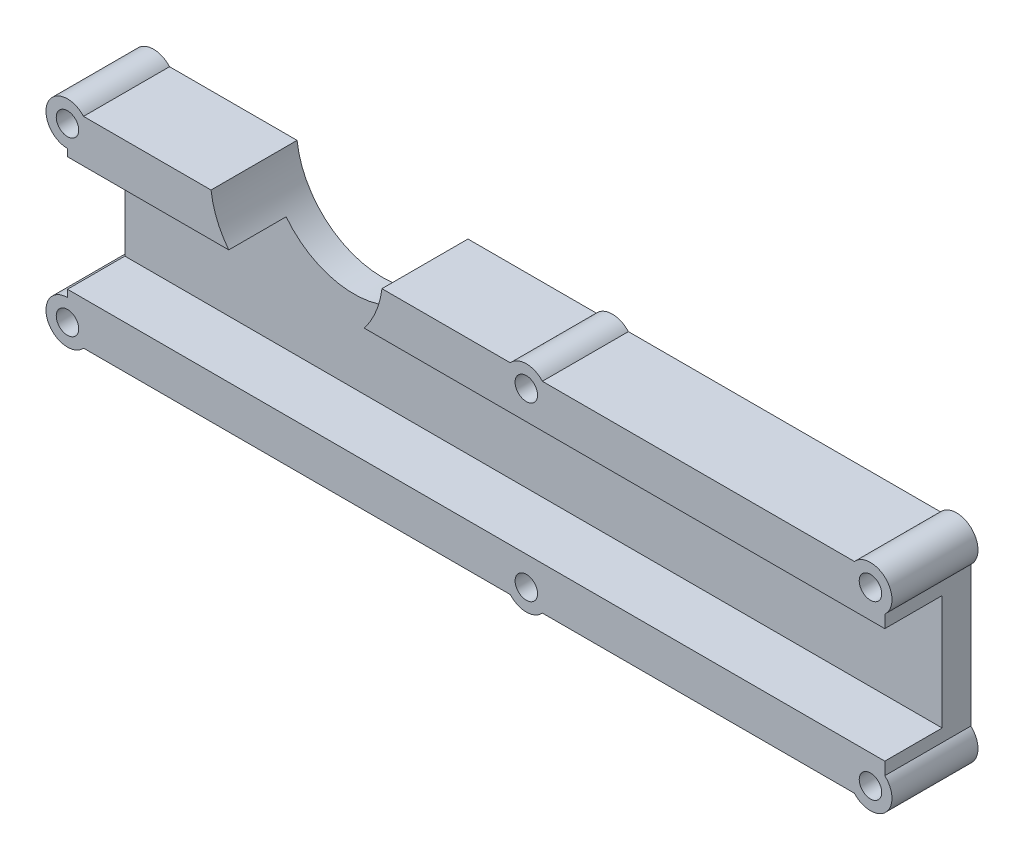
from build123d import *

# Parameters (mm, degrees)
SKETCH1_R           = 2.4892
BOSS_EXTRUDE1_DEPTH = 19.05
SKETCH2_W           = 12.7
SKETCH2_H           = 25.4
CUT_EXTRUDE1_DEPTH  = 189.491810996


with BuildPart() as part:
    # Sketch1 → Boss-Extrude1 (new body)
    with BuildSketch(Plane.XY):
        with BuildLine():
            ThreePointArc((-3.549757914, -3.175), (0, -4.7625), (3.549757914, -3.175))
            Line((3.549757914, -3.175), (72.650242086, -3.175))
            ThreePointArc((72.650242086, -3.175), (79.567596045, -3.367596045), (79.375, 3.549757914))
            Line((79.375, 3.549757914), (79.375, 34.550242086))
            ThreePointArc((79.375, 34.550242086), (79.567596045, 41.467596045), (72.650242086, 41.275))
            Line((72.650242086, 41.275), (3.549757914, 41.275))
            ThreePointArc((3.549757914, 41.275), (0, 42.8625), (-3.549757914, 41.275))
            Line((-3.549757914, 41.275), (-31.972901617, 41.275))
            ThreePointArc((-31.972901617, 41.275), (-50.8928116, 24.4475), (-69.812721583, 41.275))
            Line((-69.812721583, 41.275), (-98.050242086, 41.275))
            ThreePointArc((-98.050242086, 41.275), (-105.9475478, 40.044282483), (-101.6, 33.3375))
            Line((-101.6, 33.3375), (-101.6, 4.7625))
            ThreePointArc((-101.6, 4.7625), (-105.9475478, -1.944282483), (-98.050242086, -3.175))
            Line((-98.050242086, -3.175), (-3.549757914, -3.175))
        make_face()
        with Locations((-101.6, 0)):
            Circle(SKETCH1_R, mode=Mode.SUBTRACT)
        Circle(SKETCH1_R, mode=Mode.SUBTRACT)
        with Locations((76.2, 0)):
            Circle(SKETCH1_R, mode=Mode.SUBTRACT)
        with Locations((-101.6, 38.1)):
            Circle(SKETCH1_R, mode=Mode.SUBTRACT)
        with Locations((0, 38.1)):
            Circle(SKETCH1_R, mode=Mode.SUBTRACT)
        with Locations((76.2, 38.1)):
            Circle(SKETCH1_R, mode=Mode.SUBTRACT)
    extrude(amount=BOSS_EXTRUDE1_DEPTH)

    # Sketch2 → Cut-Extrude1 (cut, through all)
    with BuildSketch(Plane.ZY.offset(101.6)):
        with Locations((6.35, 19.05)):
            Rectangle(SKETCH2_W, SKETCH2_H)
    extrude(amount=-CUT_EXTRUDE1_DEPTH, mode=Mode.SUBTRACT)


with BuildPart() as body_2:
    # Mirror1: mirrored copy
    add(part.part.mirror(Plane.XY.offset(19.05)))


solid = body_2.part
